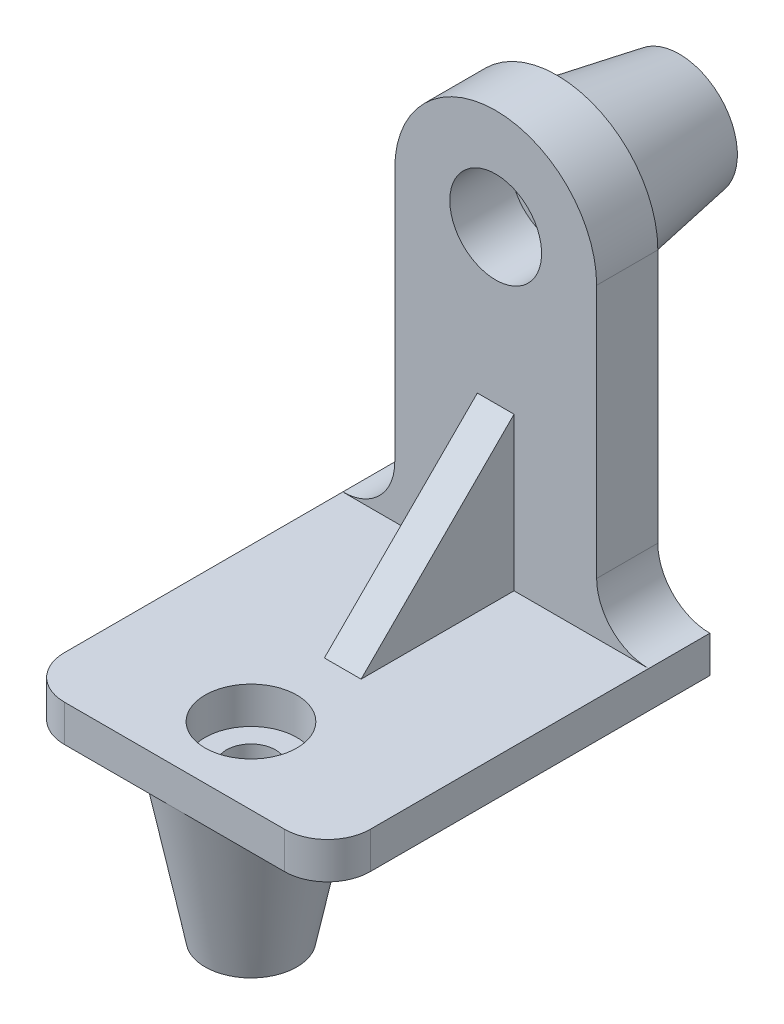
from build123d import *

# Parameters (mm, degrees)
CROQUIS1_W              = 100
CROQUIS1_H              = 125
CROQUIS1_R              = 15
SALIENTE_EXTRUIR1_DEPTH = 12
REDONDEO1_R             = 14
REDONDEO2_R             = 14
CROQUIS2_W              = 12
CROQUIS2_H              = 50
SALIENTE_EXTRUIR2_DEPTH = 50
CHAFL_N1_SIZE           = 50
CROQUIS3_R              = 15
CROQUIS3_W              = 12
CROQUIS3_H              = 50
SALIENTE_EXTRUIR6_DEPTH = 20
CROQUIS4_R              = 26
SALIENTE_EXTRUIR7_DEPTH = 40
SALIENTE_EXTRUIR7_TAPER = 9.926245507
CORTAR_EXTRUIR1_REACH   = 227.278
CROQUIS7_R              = 10
CROQUIS8_R              = 25
SALIENTE_EXTRUIR8_DEPTH = 50
SALIENTE_EXTRUIR8_TAPER = 11.30993247
CORTAR_EXTRUIR2_REACH   = 227.901
CROQUIS11_R             = 8


with BuildPart() as part:
    # Croquis1 → Saliente-Extruir1 (new body)
    with BuildSketch(Plane(origin=(0, 0, 0), x_dir=(1, 0, 0), z_dir=(0, 1, 0))):
        Rectangle(CROQUIS1_W, CROQUIS1_H)
        with Locations(Location((0, -37.5, 0), (0, 0, 270))):
            Circle(CROQUIS1_R, mode=Mode.SUBTRACT)
    extrude(amount=SALIENTE_EXTRUIR1_DEPTH)

    # Redondeo1
    redondeo1_edges = [part.edges().sort_by_distance(p)[0] for p in [
        (50, 6, 62.5),
    ]]
    fillet(redondeo1_edges, radius=REDONDEO1_R)

    # Redondeo2
    redondeo2_edges = [part.edges().sort_by_distance(p)[0] for p in [
        (-50, 6, 62.5),
    ]]
    fillet(redondeo2_edges, radius=REDONDEO2_R)

    # Croquis2 → Saliente-Extruir2 (add)
    with BuildSketch(Plane(origin=(0, 12, 0), x_dir=(1, 0, 0), z_dir=(0, 1, 0))):
        with Locations((0, 17.5)):
            Rectangle(CROQUIS2_W, CROQUIS2_H)
    extrude(amount=SALIENTE_EXTRUIR2_DEPTH)

    # Chaflán1
    chafl_n1_edges = [part.edges().sort_by_distance(p)[0] for p in [
        (0, 62, 7.5),
    ]]
    chamfer(chafl_n1_edges, length=CHAFL_N1_SIZE - 0.0001)  # a hair under: the kernel refuses the full size

    # Croquis3 → Saliente-Extruir6 (add)
    # profile 1 of 2: a face of its own
    with BuildSketch(Plane(origin=(0, 0, -42.5), x_dir=(-1, 0, 0), z_dir=(0, 0, -1))):
        with BuildLine():
            Line((6, 12), (50, 12))
            ThreePointArc((50, 12), (37.97918472, 16.97918472), (33, 29))
            Line((33, 29), (33, 112))
            ThreePointArc((33, 112), (0, 145), (-33, 112))
            Line((-33, 112), (-33, 29))
            ThreePointArc((-33, 29), (-37.97918472, 16.97918472), (-50, 12))
            Line((-50, 12), (-6, 12))
            Line((-6, 12), (-6, 62))
            Line((-6, 62), (6, 62))
            Line((6, 62), (6, 12))
        make_face()
        with Locations((0, 112)):
            Circle(CROQUIS3_R, mode=Mode.SUBTRACT)
    # profile 2 of 2: a face of its own
    with BuildSketch(Plane(origin=(0, 0, -42.5), x_dir=(-1, 0, 0), z_dir=(0, 0, -1))):
        with Locations((0, 37)):
            Rectangle(CROQUIS3_W, CROQUIS3_H)
    extrude(amount=SALIENTE_EXTRUIR6_DEPTH)

    # Croquis4 → Saliente-Extruir7 (add)
    with BuildSketch(Plane(origin=(0, 0, -62.5), x_dir=(-1, 0, 0), z_dir=(0, 0, -1))):
        with Locations((0, 112)):
            Circle(CROQUIS4_R)
    extrude(amount=SALIENTE_EXTRUIR7_DEPTH, taper=SALIENTE_EXTRUIR7_TAPER)

    # Croquis7 → Cortar-Extruir1 (cut, up to next)
    with BuildSketch(Plane(origin=(0, 0, -102.5), x_dir=(-1, 0, 0), z_dir=(0, 0, -1)), mode=Mode.PRIVATE) as cortar_extruir1_sk1:
        with Locations((0, 112)):
            Circle(CROQUIS7_R)
    cortar_extruir1_tool1 = extrude(cortar_extruir1_sk1.sketch, amount=-CORTAR_EXTRUIR1_REACH, mode=Mode.PRIVATE) & part.part
    add(cortar_extruir1_tool1.solids().sort_by_distance((0, 112, -102.5))[0], mode=Mode.SUBTRACT)

    # Croquis8 → Saliente-Extruir8 (add)
    with BuildSketch(Plane.XZ):
        with Locations((0, 37.5)):
            Circle(CROQUIS8_R)
    extrude(amount=SALIENTE_EXTRUIR8_DEPTH, taper=SALIENTE_EXTRUIR8_TAPER)

    # Croquis11 → Cortar-Extruir2 (cut, up to next)
    with BuildSketch(Plane.XZ.offset(50), mode=Mode.PRIVATE) as cortar_extruir2_sk1:
        with Locations(Location((0, 37.5, 0), (0, 0, 270))):
            Circle(CROQUIS11_R)
    cortar_extruir2_tool1 = extrude(cortar_extruir2_sk1.sketch, amount=-CORTAR_EXTRUIR2_REACH, mode=Mode.PRIVATE) & part.part
    add(cortar_extruir2_tool1.solids().sort_by_distance((0, -50, 37.5))[0], mode=Mode.SUBTRACT)


solid = part.part
